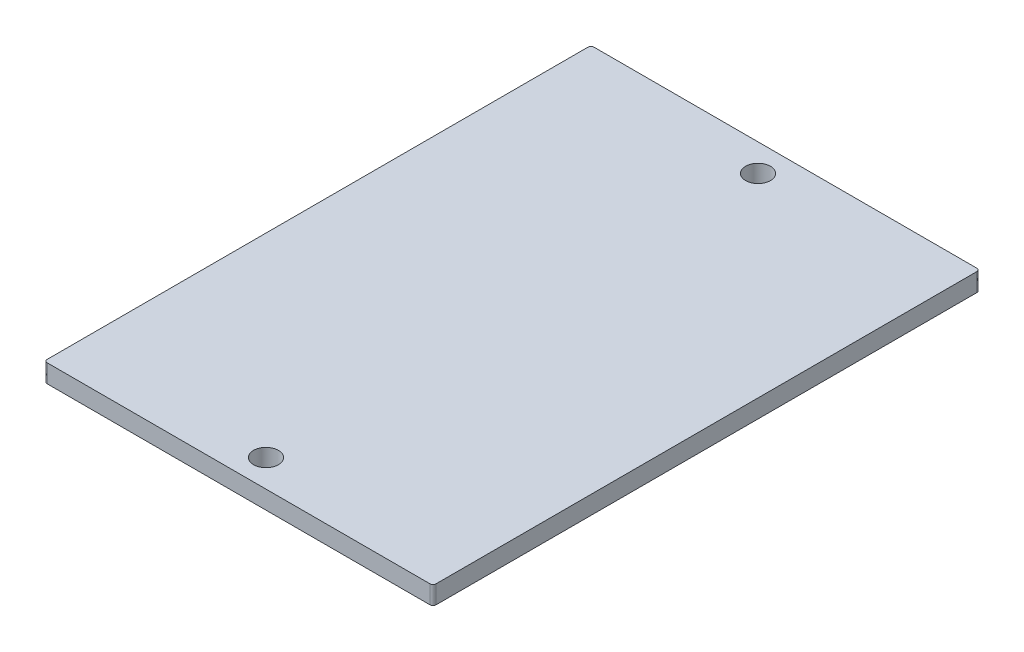
from build123d import *

# Parameters (mm, degrees)
SKETCH1_W           = 64
SKETCH1_H           = 90
SKETCH1_R           = 2.05
BOSS_EXTRUDE1_DEPTH = 3
FILLET1_R           = 0.5


with BuildPart() as part:
    # Sketch1 → Boss-Extrude1 (new body)
    with BuildSketch(Plane(origin=(0, 0, 0), x_dir=(1, 0, 0), z_dir=(0, 1, 0))):
        with Locations((32, -45)):
            Rectangle(SKETCH1_W, SKETCH1_H)
        with Locations((32, -4.5)):
            Circle(SKETCH1_R, mode=Mode.SUBTRACT)
        with Locations((32, -85.5)):
            Circle(SKETCH1_R, mode=Mode.SUBTRACT)
    extrude(amount=BOSS_EXTRUDE1_DEPTH)

    # Fillet1
    fillet1_edges = [part.edges().sort_by_distance(p)[0] for p in [
        (0, 1.5, 90),
        (64, 1.5, 90),
        (0, 1.5, 0),
        (64, 1.5, 0),
    ]]
    fillet(fillet1_edges, radius=FILLET1_R)


solid = part.part
